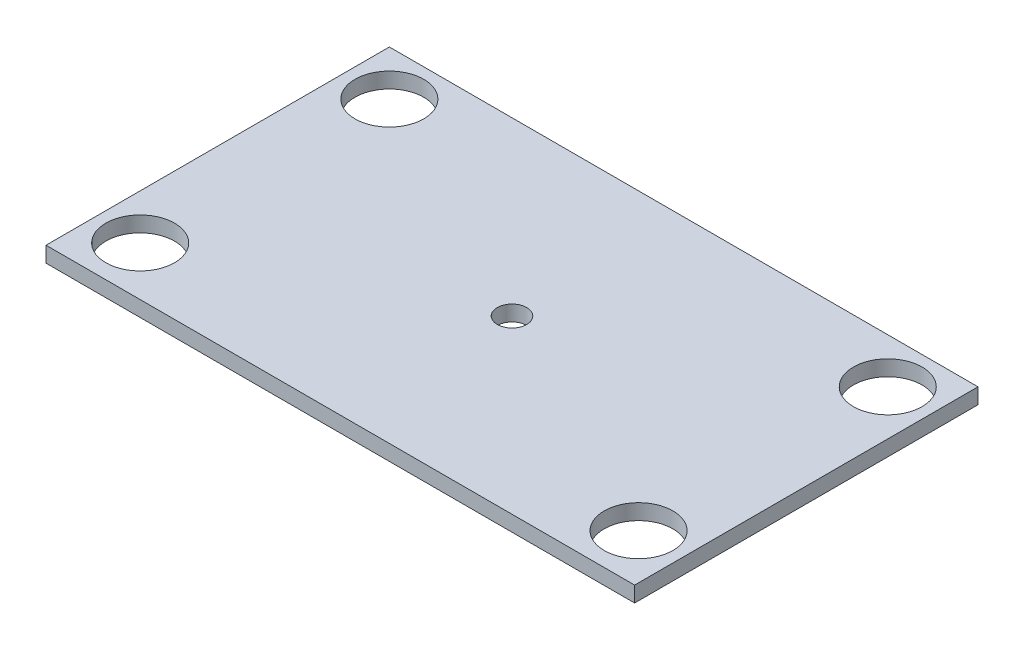
from build123d import *

# Parameters (mm, degrees)
SKETCH1_W           = 60
SKETCH1_H           = 35
SKETCH1_R           = 3.5
SKETCH1_R_2         = 1.5
BOSS_EXTRUDE1_DEPTH = 1.5875


with BuildPart() as part:
    # Sketch1 → Boss-Extrude1 (new body)
    with BuildSketch(Plane(origin=(0, 0, 0), x_dir=(1, 0, 0), z_dir=(0, 1, 0))):
        with Locations((30, 17.5)):
            Rectangle(SKETCH1_W, SKETCH1_H)
        with Locations((4.6, 30.4)):
            Circle(SKETCH1_R, mode=Mode.SUBTRACT)
        with Locations((55.4, 30.4)):
            Circle(SKETCH1_R, mode=Mode.SUBTRACT)
        with Locations((4.6, 5)):
            Circle(SKETCH1_R, mode=Mode.SUBTRACT)
        with Locations((55.4, 5)):
            Circle(SKETCH1_R, mode=Mode.SUBTRACT)
        with Locations((30, 17.5)):
            Circle(SKETCH1_R_2, mode=Mode.SUBTRACT)
    extrude(amount=BOSS_EXTRUDE1_DEPTH)


solid = part.part
